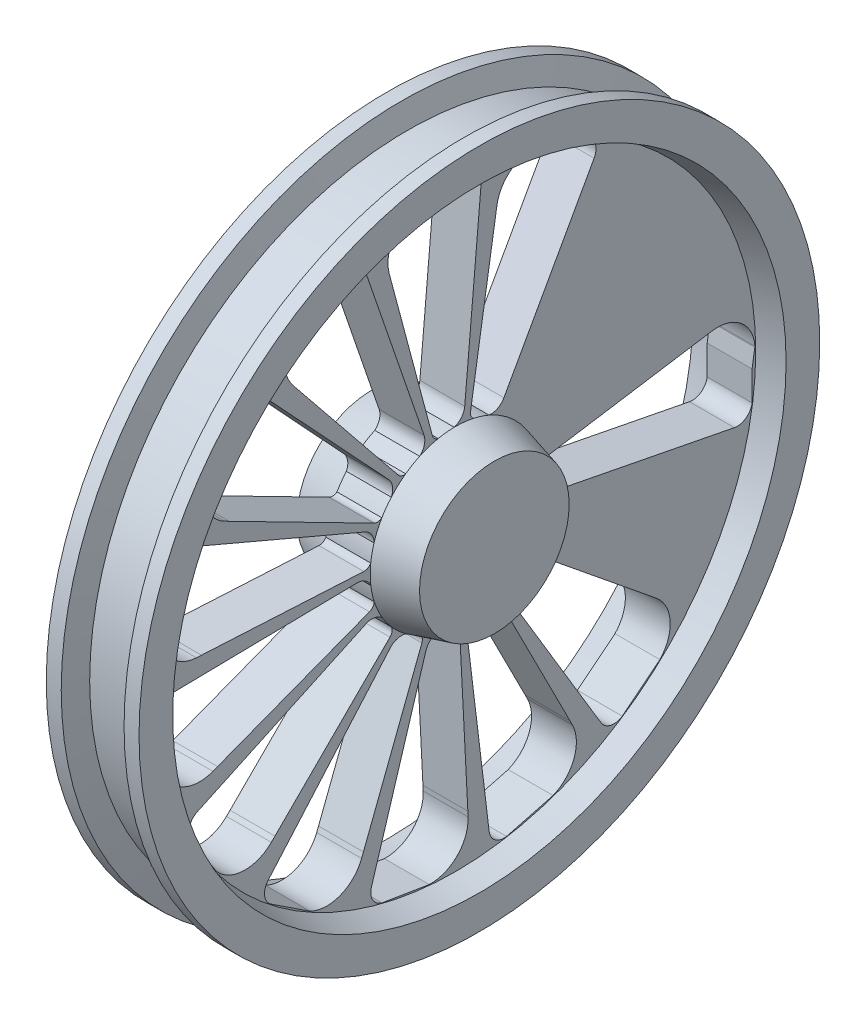
from build123d import *

# Parameters (mm, degrees)
ENL_V_MAT_EXTRU_2_DEPTH = 823.610195192


with BuildPart() as part:
    # Esquisse1 → Révolution1 (revolve)
    with BuildSketch(Plane.XY):
        Polygon((71.142535383, 233.894584229), (51.142535383, 233.894584229), (51.142535383, 188.894584229), (83.142540084, 180.320208812), (83.142540084, -107.172057764), (31.142540084, -121.105415771), (31.142540084, -221.105415771), (195.142540084, -221.105415771), (195.142540084, -121.105415771), (143.142540084, -107.172057764), (143.142540084, 180.320208812), (175.142544786, 188.894584229), (175.142535383, 233.894584229), (155.142535383, 233.894584229), (147.10405961, 203.894584229), (79.181011156, 203.894584229), align=None)
    revolve(axis=Axis((195.142540084, -221.105415771, 0), (-1, 0, 0)))

    # Esquisse2 → Enlèv. mat.-Extru.2 (cut, through all)
    with BuildSketch(Plane.ZY.offset(-83.142540084)):
        with BuildLine():
            Line((-117.161790363, 161.69368813), (-176.702916371, 138.427864958))
            ThreePointArc((-176.702916371, 138.427864958), (-186.988768737, 126.452661236), (-185.38560977, 110.748071319))
            Line((-185.38560977, 110.748071319), (-64.747794475, -106.234482231))
            ThreePointArc((-64.747794475, -106.234482231), (-56.342432468, -114.338728451), (-44.844231577, -116.368579075))
            ThreePointArc((-44.844231577, -116.368579075), (-34.70740347, -112.587185915), (-24.257601985, -109.784353915))
            ThreePointArc((-24.257601985, -109.784353915), (-20.800700583, -105.496987954), (-20.138009796, -100.029583166))
            Line((-20.138009796, -100.029583166), (-54.406250485, 114.557953446))
            Line((-54.406250485, 114.557953446), (-55.488427342, 121.23452326))
            ThreePointArc((-55.488427342, 121.23452326), (-77.418099017, 155.041381765), (-117.161790363, 161.69368813))
        make_face()
        with BuildLine():
            Line((48.665801098, 176.252960096), (-15.190786925, 179.216130737))
            ThreePointArc((-15.190786925, 179.216130737), (-29.458134795, 172.459870835), (-34.381208386, 157.460950556))
            Line((-34.381208386, 157.460950556), (-12.42783564, -89.830295648))
            ThreePointArc((-12.42783564, -89.830295648), (-8.045449261, -100.652661698), (1.633065305, -107.183762147))
            ThreePointArc((1.633065305, -107.183762147), (12.431549737, -107.852307037), (23.117932896, -109.542109772))
            ThreePointArc((23.117932896, -109.542109772), (28.019798308, -107.031454545), (30.848990336, -102.306272361))
            Line((30.848990336, -102.306272361), (86.824009, 107.667346159))
            Line((86.824009, 107.667346159), (88.550996842, 114.206857167))
            ThreePointArc((88.550996842, 114.206857167), (82.267733037, 154.010560232), (48.665801098, 176.252960096))
        make_face()
        with BuildLine():
            Line((173.193297653, 141.036288152), (148.947967584, 150.785164317))
            ThreePointArc((148.947967584, 150.785164317), (133.166078272, 150.416066951), (122.568016272, 138.716265887))
            Line((122.568016272, 138.716265887), (42.04100888, -96.124769932))
            ThreePointArc((42.04100888, -96.124769932), (41.642665214, -107.793970402), (47.82799036, -117.697034076))
            ThreePointArc((47.82799036, -117.697034076), (57.420975058, -122.699919532), (66.496167159, -128.590174757))
            ThreePointArc((66.496167159, -128.590174757), (71.99541952, -128.290345361), (76.501919785, -125.124412709))
            Line((76.501919785, -125.124412709), (213.041608559, 43.928941528))
            Line((213.041608559, 43.928941528), (217.279149212, 49.200652867))
            ThreePointArc((217.279149212, 49.200652867), (227.72872667, 88.118778627), (206.078633433, 122.105358988))
            Line((206.078633433, 122.105358988), (173.193297653, 141.036288152))
        make_face()
        with BuildLine():
            Line((-396.540673576, -238.721827067), (-396.540673576, -278.057982045))
            ThreePointArc((-396.540673576, -278.057982045), (-388.330081225, -291.540950425), (-372.898725284, -294.869240817))
            Line((-372.898725284, -294.869240817), (-129.256918717, -247.187156999))
            ThreePointArc((-129.256918717, -247.187156999), (-118.951922835, -241.697532498), (-113.468280692, -231.389351954))
            ThreePointArc((-113.468280692, -231.389351954), (-113.806565014, -226.479038972), (-113.932456317, -221.558697393))
            Line((-113.932456317, -221.558697393), (-114.498649178, -218.488519773))
            Line((-114.498649178, -218.488519773), (-113.836422662, -216.406592291))
            ThreePointArc((-113.836422662, -216.406592291), (-113.650897804, -213.087716917), (-113.368632534, -209.775666263))
            ThreePointArc((-113.368632534, -209.775666263), (-116.377918589, -205.163088715), (-121.372946825, -202.843311329))
            Line((-121.372946825, -202.843311329), (-336.047290575, -169.123149345))
            Line((-336.047290575, -169.123149345), (-342.731496843, -168.089187159))
            ThreePointArc((-342.731496843, -168.089187159), (-381.660371148, -178.498650502), (-400.26856651, -214.241471419))
            Line((-400.26856651, -214.241471419), (-400.1933835, -215.528503366))
            Line((-400.1933835, -215.528503366), (-396.540673576, -238.721827067))
        make_face()
        with BuildLine():
            Line((287.477350949, 57.874352687), (287.332265348, 58.050938081))
            ThreePointArc((287.332265348, 58.050938081), (272.764666631, 64.132823538), (258.324117421, 57.755143582))
            Line((258.324117421, 57.755143582), (89.240581035, -124.029533295))
            ThreePointArc((89.240581035, -124.029533295), (84.130384561, -134.527857413), (85.753021378, -146.090554635))
            ThreePointArc((85.753021378, -146.090554635), (92.481792138, -154.562736312), (98.376610022, -163.634965388))
            ThreePointArc((98.376610022, -163.634965388), (103.522378639, -165.597805049), (108.926972305, -164.538540446))
            Line((108.926972305, -164.538540446), (302.422378575, -65.636311242))
            Line((302.422378575, -65.636311242), (308.437762763, -62.543926355))
            ThreePointArc((308.437762763, -62.543926355), (333.813354611, -31.240675403), (327.858597883, 8.613496951))
            Line((327.858597883, 8.613496951), (287.477350949, 57.874352687))
        make_face()
        with BuildLine():
            Line((-273.276541521, -513.613881802), (-223.013496432, -553.901270635))
            ThreePointArc((-223.013496432, -553.901270635), (-207.499739609, -556.821478223), (-194.700745269, -547.580806873))
            Line((-194.700745269, -547.580806873), (-67.107249364, -334.614117395))
            ThreePointArc((-67.107249364, -334.614117395), (-64.291447263, -323.282737258), (-68.282645502, -312.310077877))
            ThreePointArc((-68.282645502, -312.310077877), (-76.625842094, -305.422023803), (-84.27806655, -297.773646252))
            ThreePointArc((-84.27806655, -297.773646252), (-89.71948509, -296.9235648), (-94.785741922, -299.083360138))
            Line((-94.785741922, -299.083360138), (-263.489879619, -436.054295424))
            Line((-263.489879619, -436.054295424), (-268.73087026, -440.32977298))
            ThreePointArc((-268.73087026, -440.32977298), (-287.028922882, -475.977814234), (-273.276541521, -513.613881802))
        make_face()
        with BuildLine():
            Line((392.948832256, -144.598852025), (376.034204101, -82.951957793))
            ThreePointArc((376.034204101, -82.951957793), (365.199766139, -71.470702759), (349.413631867, -71.423502803))
            Line((349.413631867, -71.423502803), (121.009646003, -168.719598645))
            ThreePointArc((121.009646003, -168.719598645), (112.071196118, -176.231790797), (108.850575958, -187.454826174))
            ThreePointArc((108.850575958, -187.454826174), (111.551667187, -197.931386891), (113.246843289, -208.616918992))
            ThreePointArc((113.246843289, -208.616918992), (117.14937802, -212.503034903), (122.517561743, -213.73359482))
            Line((122.517561743, -213.73359482), (339.511571914, -202.083584577))
            Line((339.511571914, -202.083584577), (346.264685064, -201.705227582))
            ThreePointArc((346.264685064, -201.705227582), (382.178620941, -183.42946791), (392.948832256, -144.598852025))
        make_face()
        with BuildLine():
            Line((390.094643705, -311.039880913), (399.716412802, -247.842841635))
            ThreePointArc((399.716412802, -247.842841635), (394.488508347, -232.947430325), (380.08635504, -226.483511758))
            Line((380.08635504, -226.483511758), (131.85504384, -222.467647686))
            ThreePointArc((131.85504384, -222.467647686), (120.63387973, -225.694781602), (113.126877078, -234.637590359))
            ThreePointArc((113.126877078, -234.637590359), (111.333245564, -245.307037594), (108.535668535, -255.758247144))
            ThreePointArc((108.535668535, -255.758247144), (110.520185672, -260.895694558), (114.923751718, -264.203304008))
            Line((114.923751718, -264.203304008), (317.896130104, -341.819905334))
            Line((317.896130104, -341.819905334), (324.219297601, -344.220997592))
            ThreePointArc((324.219297601, -344.220997592), (364.461731726, -342.132774077), (390.094643705, -311.039880913))
        make_face()
        with BuildLine():
            ThreePointArc((-156.331286722, -530.679523564), (-158.513599449, -570.780159585), (-130.494654495, -599.551016746))
            Line((-130.494654495, -599.551016746), (-68.372697821, -615.837318203))
            ThreePointArc((-68.372697821, -615.837318203), (-53.012420313, -612.195047209), (-45.078476817, -598.547453879))
            Line((-45.078476817, -598.547453879), (-15.137374573, -352.095751875))
            ThreePointArc((-15.137374573, -352.095751875), (-17.173898872, -340.598731128), (-25.283022536, -332.198074565))
            ThreePointArc((-25.283022536, -332.198074565), (-35.706535876, -329.299007828), (-45.808066179, -325.424307346))
            ThreePointArc((-45.808066179, -325.424307346), (-51.124808645, -326.860943607), (-54.874596656, -330.894647125))
            Line((-54.874596656, -330.894647125), (-153.282396917, -524.641977524))
            Line((-153.282396917, -524.641977524), (-156.331286722, -530.679523564))
        make_face()
        with BuildLine():
            Line((319.789547358, -461.93042375), (354.28402242, -408.110581644))
            ThreePointArc((354.28402242, -408.110581644), (355.566603645, -392.376565993), (345.03869445, -380.613599059))
            Line((345.03869445, -380.613599059), (119.901506731, -275.980154453))
            ThreePointArc((119.901506731, -275.980154453), (108.337869613, -274.364229362), (97.842513426, -279.480518623))
            ThreePointArc((97.842513426, -279.480518623), (91.864294352, -288.498008018), (85.057690677, -296.90778594))
            ThreePointArc((85.057690677, -296.90778594), (84.781049178, -302.408253528), (87.458580972, -307.220996788))
            Line((87.458580972, -307.220996788), (241.313559403, -460.683594188))
            Line((241.313559403, -460.683594188), (246.113448143, -465.448965035))
            ThreePointArc((246.113448143, -465.448965035), (283.726098065, -479.909350494), (319.789547358, -461.93042375))
        make_face()
        with BuildLine():
            Line((35.013115206, -619.898746747), (98.090361389, -609.520633814))
            ThreePointArc((98.090361389, -609.520633814), (110.641228057, -599.945665982), (112.338269803, -584.250943543))
            Line((112.338269803, -584.250943543), (39.449889801, -346.927967233))
            ThreePointArc((39.449889801, -346.927967233), (32.913172654, -337.253245209), (22.088264715, -332.877141303))
            ThreePointArc((22.088264715, -332.877141303), (11.386754778, -334.468336879), (0.582564987, -335.037284379))
            ThreePointArc((0.582564987, -335.037284379), (-3.690188332, -338.512230893), (-5.475135109, -343.722378606))
            Line((-5.475135109, -343.722378606), (-16.570995262, -560.745430553))
            Line((-16.570995262, -560.745430553), (-16.900603486, -567.501098518))
            ThreePointArc((-16.900603486, -567.501098518), (-2.478988864, -605.12863117), (35.013115206, -619.898746747))
        make_face()
        with BuildLine():
            Line((194.189933076, -571.18013488), (247.592705992, -536.043429584))
            ThreePointArc((247.592705992, -536.043429584), (255.164002952, -522.191363838), (250.330709012, -507.163272382))
            Line((250.330709012, -507.163272382), (87.215909837, -320.004320381))
            ThreePointArc((87.215909837, -320.004320381), (77.309257621, -313.824744411), (65.640290332, -314.229861282))
            ThreePointArc((65.640290332, -314.229861282), (56.511172086, -320.036187), (46.872465375, -324.950406291))
            ThreePointArc((46.872465375, -324.950406291), (44.382499069, -329.862813236), (44.871027039, -335.348523274))
            Line((44.871027039, -335.348523274), (123.005682017, -538.122039494))
            Line((123.005682017, -538.122039494), (125.452347631, -544.427713019))
            ThreePointArc((125.452347631, -544.427713019), (153.931644478, -572.936375437), (194.189933076, -571.18013488))
        make_face()
    extrude(amount=-ENL_V_MAT_EXTRU_2_DEPTH, mode=Mode.SUBTRACT)


solid = part.part
